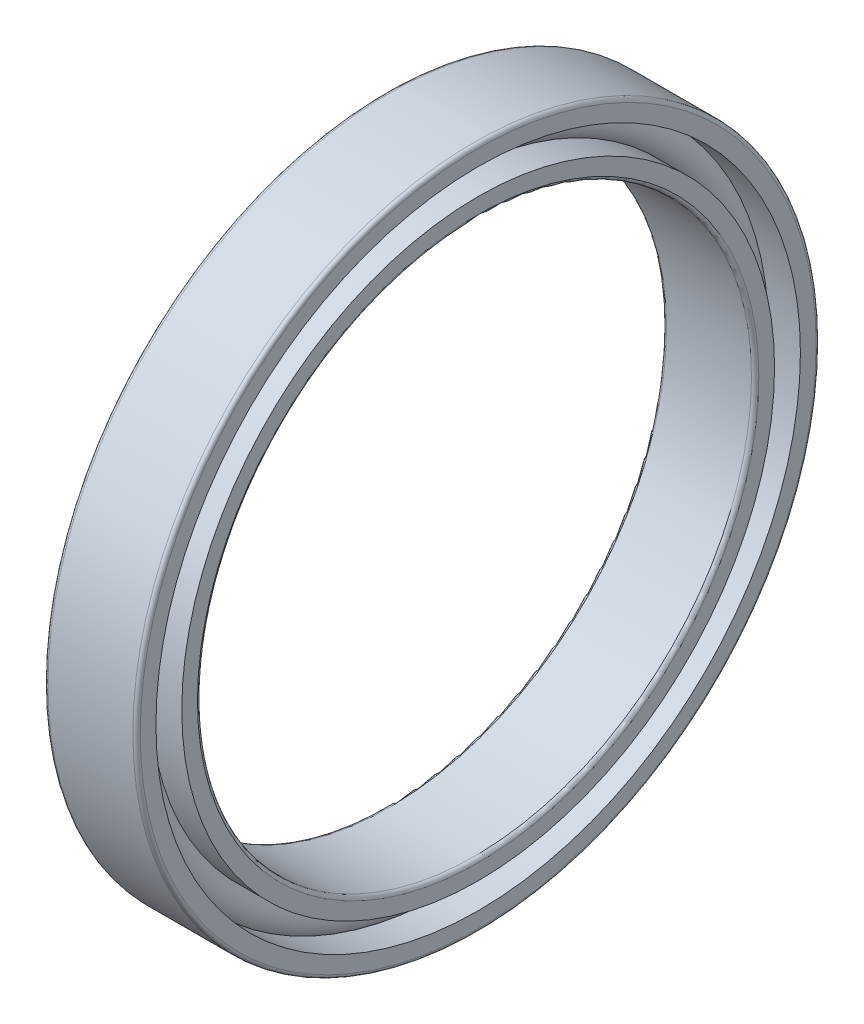
from build123d import *

# Parameters (mm, degrees)
CAGSPISKE_W     = 0.21
CAGSPISKE_H     = 0.35
CAGESPINE_ANGLE = 0.001
BALSIMSKE_R     = 1.05


with BuildPart() as part:
    # CagSpiSke → CageSpine (revolve)
    with BuildSketch(Plane.XY):
        with Locations((0, 16.75)):
            Rectangle(CAGSPISKE_W, CAGSPISKE_H)
    revolve(axis=Axis((-20.6375, 0, 0), (-1, 0, 0)), revolution_arc=CAGESPINE_ANGLE)

    # BalSimSke → BallsSimplified (revolve)
    with BuildSketch(Plane.XY):
        with Locations((0, 16.75)):
            Circle(BALSIMSKE_R)
    revolve(axis=Axis((-10, 0, 0), (1, 0, 0)))

    # InnRacSke → InnerRace (revolve)
    with BuildSketch(Plane.XY):
        with BuildLine():
            Line((-0.748748957, 16.05), (-2.5, 16.05))
            Line((-2.5, 16.05), (-2.5, 15.2))
            ThreePointArc((-2.5, 15.2), (-2.441421356, 15.058578644), (-2.3, 15))
            Line((-2.3, 15), (2.3, 15))
            ThreePointArc((2.3, 15), (2.441421356, 15.058578644), (2.5, 15.2))
            Line((2.5, 15.2), (2.5, 16.05))
            Line((2.5, 16.05), (0.748748957, 16.05))
            ThreePointArc((0.748748957, 16.05), (0, 15.725), (-0.748748957, 16.05))
        make_face()
    revolve(axis=Axis((-20.6375, 0, 0), (1, 0, 0)))

    # OutRacSke → OuterRace (revolve)
    with BuildSketch(Plane.XY):
        with BuildLine():
            Line((-0.748748957, 17.45), (-2.5, 17.45))
            Line((-2.5, 17.45), (-2.5, 18.3))
            ThreePointArc((-2.5, 18.3), (-2.441421356, 18.441421356), (-2.3, 18.5))
            Line((-2.3, 18.5), (2.3, 18.5))
            ThreePointArc((2.3, 18.5), (2.441421356, 18.441421356), (2.5, 18.3))
            Line((2.5, 18.3), (2.5, 17.45))
            Line((2.5, 17.45), (0.748748957, 17.45))
            ThreePointArc((0.748748957, 17.45), (0, 17.775), (-0.748748957, 17.45))
        make_face()
    revolve(axis=Axis((-20.6375, 0, 0), (1, 0, 0)))


solid = part.part
